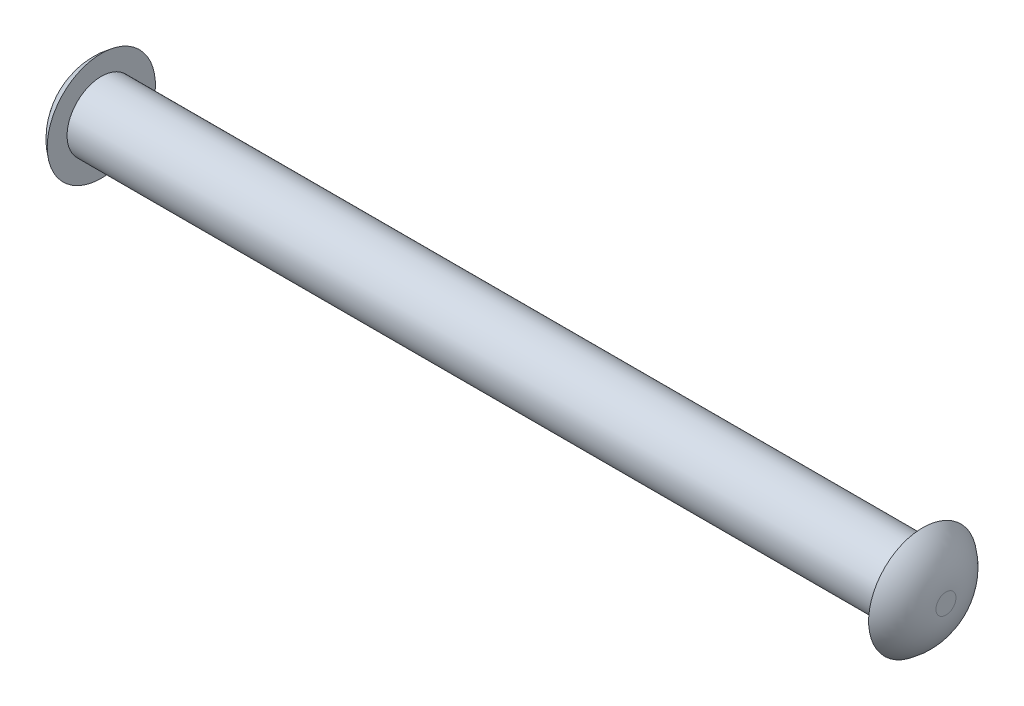
from build123d import *

# Parameters (mm, degrees)
SKETCH_1_R      = 2.5
EXTRUDE_1_DEPTH = 60
SKETCH_2_R      = 3.95
EXTRUDE_2_DEPTH = 1.7
EXTRUDE_START   = 1.7
SKETCH_3_R      = 3.95
EXTRUDE_3_DEPTH = 1.7
FILLET_1_R      = 3.9


with BuildPart() as part:
    # Эскиз1 → Бобышка-Вытянуть1 (new body)
    with BuildSketch(Plane(origin=(0, 0, 0), x_dir=(0, 0, -1), z_dir=(1, 0, 0))):
        Circle(SKETCH_1_R)
    extrude(amount=EXTRUDE_1_DEPTH)

    # Эскиз2 → Бобышка-Вытянуть2 (add)
    with BuildSketch(Plane.ZY):
        Circle(SKETCH_2_R)
    extrude(amount=EXTRUDE_2_DEPTH)

    # Эскиз3 → Бобышка-Вытянуть3 (add)
    with BuildSketch(Plane(origin=(60, 0, 0), x_dir=(0, 0, -1), z_dir=(1, 0, 0)).offset(EXTRUDE_START)):
        with Locations(Location((0, 0, 0), (0, 0, 180))):
            Circle(SKETCH_3_R)
    extrude(amount=-EXTRUDE_3_DEPTH)

    # Скругление1
    # the kernel refuses this fillet: 3.9 mm, written as the material it takes off along each edge
    with BuildSketch(Plane(origin=(61.7, 0, 0), x_dir=(0, 0, 1), z_dir=(0, 1, 0))) as fillet_1_piece_1:
        with BuildLine():
            CenterArc((0.729751562, -3.9), FILLET_1_R, 34.339994944, 55.660005056)
            Line((0.729751562, 0), (0.729751562, 0.078))
            Line((0.729751562, 0.078), (3.95, 0.078))
            Line((3.95, 0.078), (4.028, 0))
            ThreePointArc((4.028, 0), (4.028, -0.85), (4.014404969, -1.656))
            Line((4.014404969, -1.656), (3.95, -1.7))
        make_face()
    revolve(axis=Axis((61.7, 0, 0), (1, 0, 0)), mode=Mode.SUBTRACT)
    with BuildSketch(Plane(origin=(-1.7, 0, 0), x_dir=(0, 0, 1), z_dir=(0, -1, 0))) as fillet_1_piece_2:
        with BuildLine():
            CenterArc((0.729751562, -3.9), FILLET_1_R, 34.339994944, 55.660005056)
            Line((0.729751562, 0), (0.729751562, 0.078))
            Line((0.729751562, 0.078), (3.95, 0.078))
            Line((3.95, 0.078), (4.028, 0))
            ThreePointArc((4.028, 0), (4.028, -0.85), (4.014404969, -1.656))
            Line((4.014404969, -1.656), (3.95, -1.7))
        make_face()
    revolve(axis=Axis((-1.7, 0, 0), (-1, 0, 0)), mode=Mode.SUBTRACT)


solid = part.part
